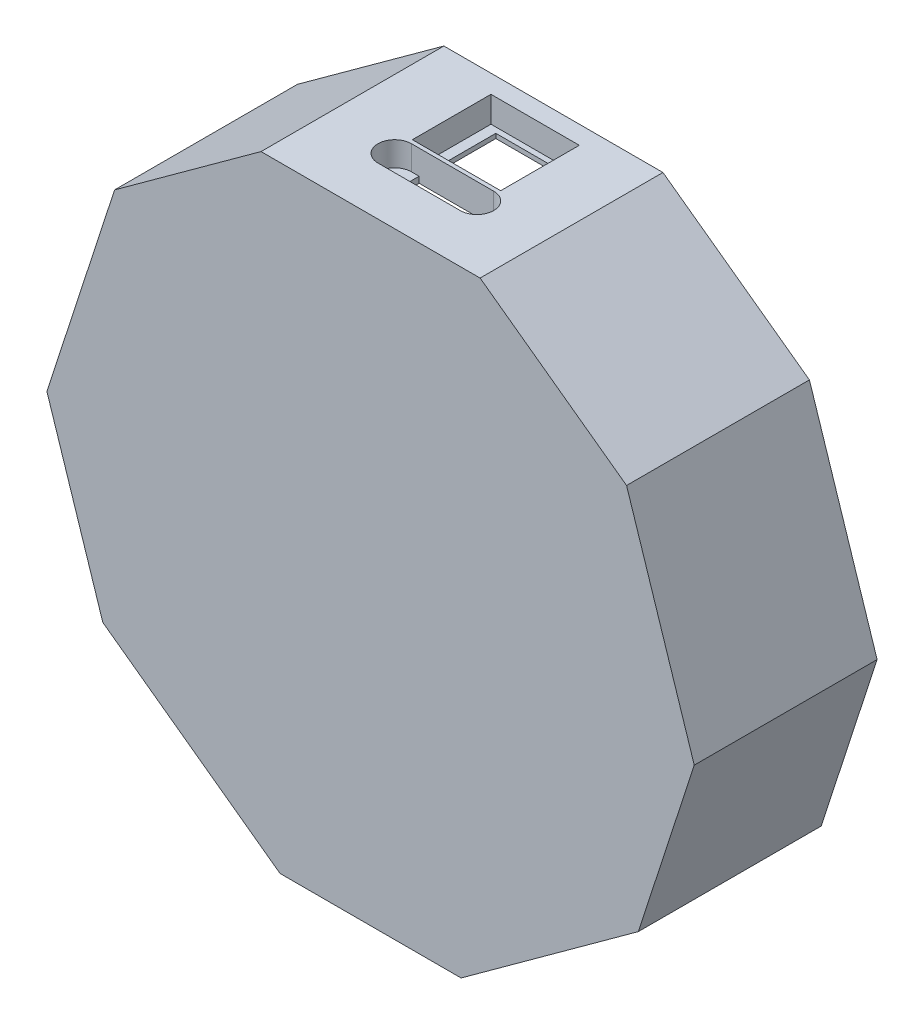
from build123d import *

# Parameters (mm, degrees)
BOSS_EXTRUDE1_DEPTH      = 32.5
SKETCH4_R                = 1.05
BOSS_EXTRUDE2_DEPTH      = 2.5
SKETCH5_R                = 1.05
BOSS_EXTRUDE3_DEPTH      = 3
CUT_EXTRUDE1_DEPTH       = 57.494113711
SKETCH13_W               = 30.122
SKETCH13_H               = 38
BOSS_EXTRUDE7_DEPTH      = 2.5
BOSS_EXTRUDE4_DEPTH      = 5
BOSS_EXTRUDE6_DEPTH      = 5
CUT_EXTRUDE2_DEPTH       = 88.339560135
SKETCH14_W               = 15
SKETCH14_H               = 5
CUT_EXTRUDE3_DEPTH       = 78.191649756
SKETCH15_W               = 30.122
SKETCH15_H               = 34.5
SKETCH15_R               = 2.495
BOSS_EXTRUDE8_DEPTH      = 3
SKETCH17_R               = 13.75
CUT_EXTRUDE4_DEPTH       = 82.57236537
CUT_EXTRUDE6_DEPTH       = 78.191649756
CUT_EXTRUDE6_DEPTH_BACK  = 78.191649756
SKETCH19_W               = 15
SKETCH19_H               = 3
SKETCH21_R               = 2.25
CUT_EXTRUDE8_DEPTH       = 1.5
SKETCH20_R               = 10
CUT_EXTRUDE7_DEPTH       = 80.23730682
CIRPATTERN2_COUNT        = 5
CHAMFER1_SIZE2           = 2
CHAMFER1_SIZE            = 1.154700538
SKETCH22_R               = 1.575
CUT_EXTRUDE9_DEPTH       = 170.45894052
SKETCH23_R               = 2.6
CUT_EXTRUDE10_DEPTH      = 3
CIRPATTERN3_COUNT        = 5
BOSS_EXTRUDE9_DEPTH      = 55
CUT_EXTRUDE11_DEPTH      = 187.975043137
CUT_EXTRUDE11_DEPTH_BACK = 187.975043137
BOSS_EXTRUDE10_DEPTH     = 5
CUT_EXTRUDE12_DEPTH      = 50
CHAMFER2_SIZE            = 3
SKETCH30_W               = 28.98
SKETCH30_H               = 25.8
CUT_EXTRUDE15_DEPTH      = 8.5
CUT_EXTRUDE16_REACH      = 231.436
SKETCH33_W               = 22.225
SKETCH33_H               = 22.225
CUT_EXTRUDE14_DEPTH      = 8
CUT_EXTRUDE17_REACH      = 231.857
SKETCH34_R               = 2.25
SKETCH34_W               = 22
SKETCH34_H               = 11


with BuildPart() as part:
    # Sketch2 → Boss-Extrude1 (new body)
    with BuildSketch(Plane(origin=(0, 0, 0), x_dir=(1, 0, 0), z_dir=(0, 1, 0))):
        Polygon((15.061, 0), (15.061, 32), (12.561, 32), (12.561, 2.5), (-12.561, 2.5), (-12.561, 32), (-15.061, 32), (-15.061, 0), align=None)
    extrude(amount=BOSS_EXTRUDE1_DEPTH)

    # Sketch4 → Boss-Extrude2 (add)
    # profile 1 of 2: a face of its own
    with BuildSketch(Plane.XZ):
        Polygon((-7.561, -6), (-7.561, 0), (-15.061, 0), (-15.061, -32), (-12.561, -32), (-12.561, -10), align=None)
        with Locations(Location((-10.2499, -4.95, 0), (0, 0, 270))):
            Circle(SKETCH4_R, mode=Mode.SUBTRACT)
    # profile 2 of 2: a face of its own
    with BuildSketch(Plane.XZ):
        Polygon((12.561, -10), (7.561, -6), (7.561, 0), (15.061, 0), (15.061, -32), (12.561, -32), align=None)
        with Locations(Location((10.2499, -4.95, 0), (0, 0, 270))):
            Circle(SKETCH4_R, mode=Mode.SUBTRACT)
    extrude(amount=BOSS_EXTRUDE2_DEPTH)

    # Sketch5 → Boss-Extrude3 (add)
    with BuildSketch(Plane(origin=(0, 32.5, 0), x_dir=(1, 0, 0), z_dir=(0, 1, 0))):
        Polygon((-15.061, 32), (-10.2499, 32), (-6.25, 26), (6.25, 26), (10.2499, 32), (15.061, 32), (15.061, 0), (-15.061, 0), align=None)
        with Locations(Location((-10.2499, 8.7, 0), (0, 0, 270))):
            Circle(SKETCH5_R, mode=Mode.SUBTRACT)
        with Locations(Location((10.2499, 8.7, 0), (0, 0, 270))):
            Circle(SKETCH5_R, mode=Mode.SUBTRACT)
    extrude(amount=BOSS_EXTRUDE3_DEPTH)

    # Sketch6 → Cut-Extrude1 (cut, through all)
    with BuildSketch(Plane.ZY.offset(15.061)):
        Polygon((-12.5, 35.5), (-32, 2.5), (-32, 35.5), align=None)
    extrude(amount=-CUT_EXTRUDE1_DEPTH, mode=Mode.SUBTRACT)

    # Sketch13 → Boss-Extrude7 (add)
    with BuildSketch(Plane.XY):
        with Locations((0, 16.5)):
            Rectangle(SKETCH13_W, SKETCH13_H)
    extrude(amount=BOSS_EXTRUDE7_DEPTH)

    # Sketch8 → Boss-Extrude4 (add)
    with BuildSketch(Plane.XY.offset(2.5)):
        Polygon((0, -43.5), (-43.59255168, 16.5), (43.59255168, 16.5), align=None)
    extrude(amount=BOSS_EXTRUDE4_DEPTH)

    # Sketch9 → Boss-Extrude6 (add)
    with BuildSketch(Plane.XY.offset(2.5)):
        Polygon((43.59255168, 16.5), (65.38882752, 46.5), (-65.38882752, 46.5), (-43.59255168, 16.5), align=None)
    extrude(amount=BOSS_EXTRUDE6_DEPTH)

    # Sketch10 → Cut-Extrude2 (cut, through all)
    with BuildSketch(Plane(origin=(0, 0, 2.5), x_dir=(-1, 0, 0), z_dir=(0, 0, -1))):
        Polygon((-65.38882752, 46.5), (-54.092982836, 30.9526036), (-32.69382752, 46.5), align=None)
        Polygon((54.092982836, 30.9526036), (65.38882752, 46.5), (32.69382752, 46.5), align=None)
    extrude(amount=-CUT_EXTRUDE2_DEPTH, mode=Mode.SUBTRACT)

    # Sketch14 → Cut-Extrude3 (cut, through all)
    with BuildSketch(Plane(origin=(0, 0, -2.5), x_dir=(-1, 0, 0), z_dir=(0, 0, -1))):
        Polygon((-7.561, -2.5), (7.561, -2.5), (7.561, 0), (12.561, 0), (12.561, 7.783674653), (-12.561, 7.783674653), (-12.561, 0), (-7.561, 0), align=None)
        with Locations((0, 38)):
            Rectangle(SKETCH14_W, SKETCH14_H)
    extrude(amount=-CUT_EXTRUDE3_DEPTH, mode=Mode.SUBTRACT)

    # Sketch15 → Boss-Extrude8 (add)
    with BuildSketch(Plane.XZ.offset(2.5)):
        with Locations((0, -14.75)):
            Rectangle(SKETCH15_W, SKETCH15_H)
        with Locations(Location((-10.2499, -4.95, 0), (0, 0, 270))):
            Circle(SKETCH15_R, mode=Mode.SUBTRACT)
        with Locations(Location((10.340989886, -4.95, 0), (0, 0, 270))):
            Circle(SKETCH15_R, mode=Mode.SUBTRACT)
    extrude(amount=BOSS_EXTRUDE8_DEPTH)

    # Sketch17 → Cut-Extrude4 (cut, through all)
    with BuildSketch(Plane.XZ.offset(5.5)):
        with Locations((0, -37.5)):
            Circle(SKETCH17_R)
    extrude(amount=-CUT_EXTRUDE4_DEPTH, mode=Mode.SUBTRACT)

    # Sketch19 → Cut-Extrude6 (cut, two sides: drawn at the far end of the back side and taken through both)
    with BuildSketch(Plane(origin=(0, 0, -2.5), x_dir=(-1, 0, 0), z_dir=(0, 0, -1)).offset(-CUT_EXTRUDE6_DEPTH_BACK)):
        with Locations((0, 34)):
            Rectangle(SKETCH19_W, SKETCH19_H)
    extrude(amount=CUT_EXTRUDE6_DEPTH + CUT_EXTRUDE6_DEPTH_BACK, mode=Mode.SUBTRACT)

    # Sketch21 → Cut-Extrude8 (cut)
    with BuildSketch(Plane(origin=(0, 35.5, 0), x_dir=(1, 0, 0), z_dir=(0, 1, 0))):
        with Locations(Location((-10.2499, 8.7, 0), (0, 0, 270))):
            Circle(SKETCH21_R)
        with Locations(Location((10.2499, 8.7, 0), (0, 0, 270))):
            Circle(SKETCH21_R)
    extrude(amount=-CUT_EXTRUDE8_DEPTH, mode=Mode.SUBTRACT)

    # Sketch20 → Cut-Extrude7 (cut, through all)
    with BuildSketch(Plane(origin=(0, 0, 2.5), x_dir=(-1, 0, 0), z_dir=(0, 0, -1))):
        with Locations((0, -43.5)):
            Circle(SKETCH20_R)
    extrude(amount=-CUT_EXTRUDE7_DEPTH, mode=Mode.SUBTRACT)


with BuildPart() as cirpattern2_1:
    # CirPattern2: pattern copy
    add(part.part.rotate(Axis((0, -43.5, 0), (0, 0, 1)), 1 * 360 / CIRPATTERN2_COUNT))


with BuildPart() as cirpattern2_2:
    # CirPattern2: pattern copy
    add(part.part.rotate(Axis((0, -43.5, 0), (0, 0, 1)), 2 * 360 / CIRPATTERN2_COUNT))


with BuildPart() as cirpattern2_3:
    # CirPattern2: pattern copy
    add(part.part.rotate(Axis((0, -43.5, 0), (0, 0, 1)), 3 * 360 / CIRPATTERN2_COUNT))


with BuildPart() as cirpattern2_4:
    # CirPattern2: pattern copy
    add(part.part.rotate(Axis((0, -43.5, 0), (0, 0, 1)), 4 * 360 / CIRPATTERN2_COUNT))


with BuildPart() as cirpattern2_3_1:
    add(cirpattern2_3.part)

    # Combine1: union CirPattern2_2, CirPattern2_1, part, CirPattern2_4
    add(cirpattern2_2.part)
    add(cirpattern2_1.part)
    add(part.part)
    add(cirpattern2_4.part)

    # Chamfer1
    chamfer1_edges = [cirpattern2_3_1.edges().sort_by_distance(p)[0] for p in [
        (52.900672706, -116.311529494, 7.5),
        (0, -135.528479151, 7.5),
        (87.524284782, -71.938364024, 7.5),
        (24.099195344, -76.669696769, 7.5),
        (18.716949415, -82.125212305, 7.5),
        (17.429138494, -84.605946679, 7.5),
        (17.694160593, -89.223972346, 7.5),
        (30.143787645, -84.989364329, 7.5),
        (38.018285526, -74.457631238, 7.5),
        (33.708178455, -72.778531832, 7.5),
        (30.950904404, -73.23672372, 7.5),
        (40.955192726, -112.629748942, 7.5),
        (49.373961193, -111.457427527, 7.5),
        (53.090447641, -103.812970158, 7.5),
        (44.671679174, -104.985291572, 7.5),
        (-5.877852523, -51.590169944, 7.5),
        (-52.900672706, -116.311529494, 7.5),
        (-33.708178455, -72.778531832, 7.5),
        (-30.950904404, -73.23672372, 7.5),
        (-24.099195344, -76.669696769, 7.5),
        (-18.716949415, -82.125212305, 7.5),
        (-17.429138494, -84.605946679, 7.5),
        (-17.694160593, -89.223972346, 7.5),
        (-30.143787645, -84.989364329, 7.5),
        (-38.018285526, -74.457631238, 7.5),
        (-44.671679174, -104.985291572, 7.5),
        (-40.955192726, -112.629748942, 7.5),
        (-49.373961193, -111.457427527, 7.5),
        (-53.090447641, -103.812970158, 7.5),
        (54.092982836, 30.9526036, 7.5),
        (-54.092982836, 30.9526036, 7.5),
        (-87.524284782, -71.938364024, 7.5),
        (-38.261938478, -20.489181134, 7.5),
        (-37.845660319, -23.253093668, 7.5),
        (-38.993317168, -30.830303231, 7.5),
        (-42.518615308, -37.634970307, 7.5),
        (-44.479978439, -39.626340355, 7.5),
        (-48.953878175, -40.801337773, 7.5),
        (-48.773672959, -27.652472998, 7.5),
        (-41.190753242, -16.90889597, 7.5),
        (-72.280295238, -20.014708428, 7.5),
        (-78.402148761, -25.911564322, 7.5),
        (-79.888747369, -17.542572473, 7.5),
        (-73.766893846, -11.645716578, 7.5),
        (10.061, 0, 7.5),
        (7.561, -1.25, 7.5),
        (0, -2.5, 7.5),
        (-7.561, -1.25, 7.5),
        (-10.061, 0, 7.5),
        (-12.561, 3.891837327, 7.5),
        (0, 7.783674653, 7.5),
        (12.561, 3.891837327, 7.5),
        (0, 32.5, 7.5),
        (-7.5, 36.5, 7.5),
        (0, 40.5, 7.5),
        (7.5, 36.5, 7.5),
        (44.479978439, -39.626340355, 7.5),
        (42.518615308, -37.634970307, 7.5),
        (38.993317168, -30.830303231, 7.5),
        (37.845660319, -23.253093668, 7.5),
        (38.261938478, -20.489181134, 7.5),
        (41.190753242, -16.90889597, 7.5),
        (48.773672959, -27.652472998, 7.5),
        (48.953878175, -40.801337773, 7.5),
        (72.280295238, -20.014708428, 7.5),
        (73.766893846, -11.645716578, 7.5),
        (79.888747369, -17.542572473, 7.5),
        (78.402148761, -25.911564322, 7.5),
        (-85.595086467, -15.688470506, 7.5),
        (0, 46.5, 7.5),
        (85.595086467, -15.688470506, 7.5),
    ]]
    chamfer(chamfer1_edges, length=CHAMFER1_SIZE, length2=CHAMFER1_SIZE2)

    # Sketch22 → Cut-Extrude9 (cut, through all)
    with BuildSketch(Plane(origin=(0, 0, 2.5), x_dir=(-1, 0, 0), z_dir=(0, 0, -1))):
        with Locations((0, -123.5)):
            Circle(SKETCH22_R)
    cut_extrude9 = extrude(amount=-CUT_EXTRUDE9_DEPTH, mode=Mode.SUBTRACT)

    # Sketch23 → Cut-Extrude10 (cut)
    with BuildSketch(Plane(origin=(0, 0, 2.5), x_dir=(-1, 0, 0), z_dir=(0, 0, -1))):
        with Locations((0, -123.5)):
            Circle(SKETCH23_R)
    cut_extrude10 = extrude(amount=-CUT_EXTRUDE10_DEPTH, mode=Mode.SUBTRACT)

    # CirPattern3: Cut-Extrude9, Cut-Extrude10 ×5 about axis
    cirpattern3_axis = Axis((0, -43.5, 0), (0, 0, 1))
    add([cut_extrude9.rotate(cirpattern3_axis, i * 360 / CIRPATTERN3_COUNT) for i in range(1, CIRPATTERN3_COUNT)], mode=Mode.SUBTRACT)
    add([cut_extrude10.rotate(cirpattern3_axis, i * 360 / CIRPATTERN3_COUNT) for i in range(1, CIRPATTERN3_COUNT)], mode=Mode.SUBTRACT)

    # Sketch24 → Boss-Extrude9 (add)
    with BuildSketch(Plane(origin=(0, 0, 2.5), x_dir=(-1, 0, 0), z_dir=(0, 0, -1))):
        Polygon((87.857042865, -103.274919724), (106.212657024, -46.782148212), (83.998646235, 21.585547087), (35.943024483, 56.5), (-35.943024483, 56.5), (-83.998646235, 21.585547087), (-106.212657024, -46.782148212), (-87.857042865, -103.274919724), (-29.700007593, -145.528479151), (29.700007593, -145.528479151), align=None)
        Polygon((-32.69382752, 46.5), (32.69382752, 46.5), (75.492138152, 15.4052072), (95.698034782, -46.782148212), (79.350534782, -97.094579836), (26.450810631, -135.528479151), (-26.450810631, -135.528479151), (-79.350534782, -97.094579836), (-95.698034782, -46.782148212), (-75.492138152, 15.4052072), align=None, mode=Mode.SUBTRACT)
    extrude(amount=-BOSS_EXTRUDE9_DEPTH)

    # Sketch25 → Cut-Extrude11 (cut, two sides: drawn at the far end of the back side and taken through both)
    with BuildSketch(Plane.XY.offset(7.5).offset(-CUT_EXTRUDE11_DEPTH_BACK)):
        Polygon((-32.69382752, 46.5), (32.69382752, 46.5), (75.492138152, 15.4052072), (95.698034782, -46.782148212), (79.350534782, -97.094579836), (26.450810631, -135.528479151), (-26.450810631, -135.528479151), (-79.350534782, -97.094579836), (-95.698034782, -46.782148212), (-75.492138152, 15.4052072), align=None)
    extrude(amount=CUT_EXTRUDE11_DEPTH + CUT_EXTRUDE11_DEPTH_BACK, mode=Mode.SUBTRACT)

    # Sketch26 → Boss-Extrude10 (add)
    with BuildSketch(Plane.XY.offset(57.5)):
        Polygon((-83.998646235, 21.585547087), (-35.943024483, 56.5), (35.943024483, 56.5), (83.998646235, 21.585547087), (106.212657024, -46.782148212), (87.857042865, -103.274919724), (29.700007593, -145.528479151), (-29.700007593, -145.528479151), (-87.857042865, -103.274919724), (-106.212657024, -46.782148212), align=None)
    extrude(amount=BOSS_EXTRUDE10_DEPTH)

    # Sketch29 → Cut-Extrude12 (cut)
    with BuildSketch(Plane(origin=(0, 0, 57.5), x_dir=(-1, 0, 0), z_dir=(0, 0, -1))):
        Polygon((-41.200335604, 46.5), (41.200335604, 46.5), (79.745392193, 18.495377143), (100.955345903, -46.782148212), (83.603788823, -100.18474978), (28.075409112, -140.528479151), (-28.075409112, -140.528479151), (-83.603788823, -100.18474978), (-100.955345903, -46.782148212), (-79.745392193, 18.495377143), align=None)
    extrude(amount=CUT_EXTRUDE12_DEPTH, mode=Mode.SUBTRACT)

    # Chamfer2
    chamfer2_edges = [cirpattern2_3_1.edges().sort_by_distance(p)[0] for p in [
        (-36.947081562, 46.5, 7.5),
        (60.472863899, 32.497688572, 7.5),
        (90.350369048, -14.143385534, 7.5),
        (92.279567363, -73.483448996, 7.5),
        (55.839598968, -120.356614466, 7.5),
        (0, -140.528479151, 7.5),
        (-55.839598968, -120.356614466, 7.5),
        (-92.279567363, -73.483448996, 7.5),
        (-90.350369048, -14.143385534, 7.5),
        (-60.472863899, 32.497688572, 7.5),
    ]]
    chamfer(chamfer2_edges, length=CHAMFER2_SIZE)

    # Sketch30 → Cut-Extrude15 (cut)
    with BuildSketch(Plane(origin=(0, 56.5, 0), x_dir=(1, 0, 0), z_dir=(0, 1, 0))):
        with Locations((0, -21.4)):
            Rectangle(SKETCH30_W, SKETCH30_H)
    extrude(amount=-CUT_EXTRUDE15_DEPTH, mode=Mode.SUBTRACT)

    # Sketch33 → Cut-Extrude16 (cut, up to next)
    with BuildSketch(Plane(origin=(0, 48, 0), x_dir=(1, 0, 0), z_dir=(0, 1, 0)), mode=Mode.PRIVATE) as cut_extrude16_sk1:
        with Locations((0, -21.4)):
            Rectangle(SKETCH33_W, SKETCH33_H)
    cut_extrude16_tool1 = extrude(cut_extrude16_sk1.sketch, amount=-CUT_EXTRUDE16_REACH, mode=Mode.PRIVATE) & cirpattern2_3_1.part
    add(cut_extrude16_tool1.solids().sort_by_distance((0, 48, 21.4))[0], mode=Mode.SUBTRACT)

    # Sketch32 → Cut-Extrude14 (cut)
    with BuildSketch(Plane(origin=(0, 56.5, 0), x_dir=(1, 0, 0), z_dir=(0, 1, 0))):
        with BuildLine():
            Line((-13.5, -35.582576287), (13.5, -35.582576287))
            ThreePointArc((13.5, -35.582576287), (19, -41.082576287), (13.5, -46.582576287))
            Line((13.5, -46.582576287), (-13.5, -46.582576287))
            ThreePointArc((-13.5, -46.582576287), (-19, -41.082576287), (-13.5, -35.582576287))
        make_face()
    extrude(amount=-CUT_EXTRUDE14_DEPTH, mode=Mode.SUBTRACT)

    # Sketch34 → Cut-Extrude17 (cut, up to next)
    with BuildSketch(Plane(origin=(0, 48.5, 0), x_dir=(1, 0, 0), z_dir=(0, 1, 0)), mode=Mode.PRIVATE) as cut_extrude17_sk1:
        with Locations(Location((-13.6, -41.350525767, 0), (0, 0, 180))):
            Circle(SKETCH34_R)
    cut_extrude17_tool1 = extrude(cut_extrude17_sk1.sketch, amount=-CUT_EXTRUDE17_REACH, mode=Mode.PRIVATE) & cirpattern2_3_1.part
    # Sketch34 → Cut-Extrude17 (cut, up to next)
    with BuildSketch(Plane(origin=(0, 48.5, 0), x_dir=(1, 0, 0), z_dir=(0, 1, 0)), mode=Mode.PRIVATE) as cut_extrude17_sk2:
        with Locations(Location((13.6, -41.350525767, 0), (0, 0, 180))):
            Circle(SKETCH34_R)
    cut_extrude17_tool2 = extrude(cut_extrude17_sk2.sketch, amount=-CUT_EXTRUDE17_REACH, mode=Mode.PRIVATE) & cirpattern2_3_1.part
    # Sketch34 → Cut-Extrude17 (cut, up to next)
    with BuildSketch(Plane(origin=(0, 48.5, 0), x_dir=(1, 0, 0), z_dir=(0, 1, 0)), mode=Mode.PRIVATE) as cut_extrude17_sk3:
        with Locations((0, -41.082576287)):
            Rectangle(SKETCH34_W, SKETCH34_H)
    cut_extrude17_tool3 = extrude(cut_extrude17_sk3.sketch, amount=-CUT_EXTRUDE17_REACH, mode=Mode.PRIVATE) & cirpattern2_3_1.part
    add(cut_extrude17_tool1.solids().sort_by_distance((-13.6, 48.5, 41.350526))[0], mode=Mode.SUBTRACT)
    add(cut_extrude17_tool2.solids().sort_by_distance((13.6, 48.5, 41.350526))[0], mode=Mode.SUBTRACT)
    add(cut_extrude17_tool3.solids().sort_by_distance((0, 48.5, 41.082576))[0], mode=Mode.SUBTRACT)


solid = cirpattern2_3_1.part
